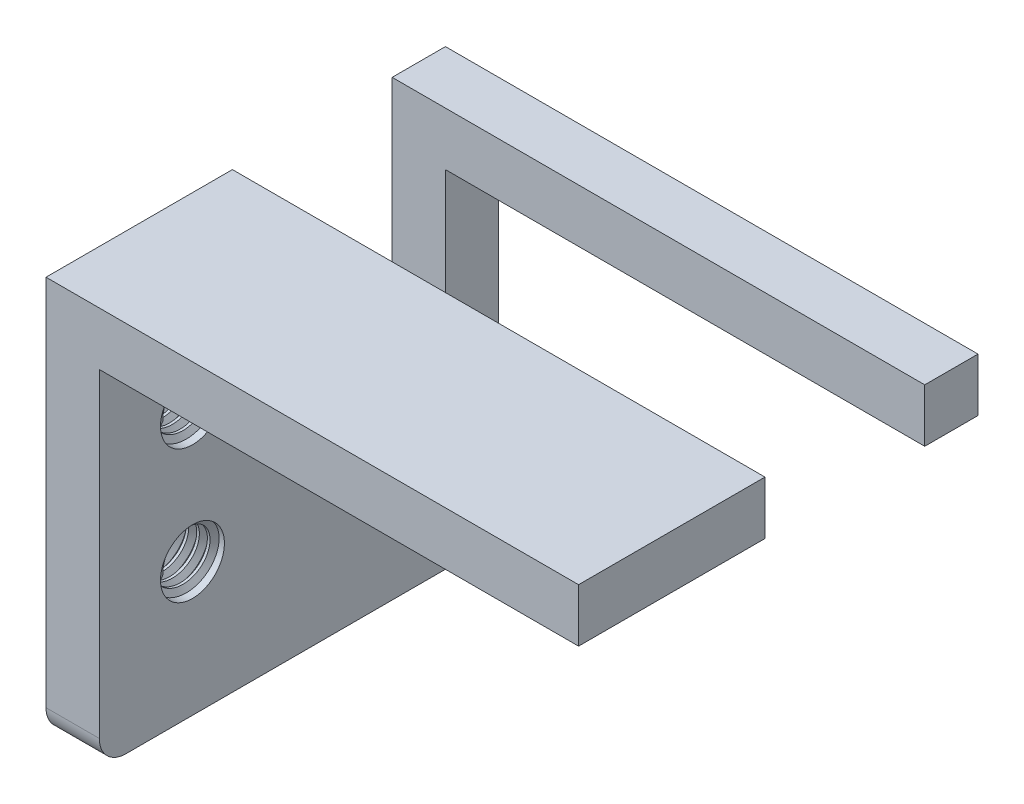
from build123d import *

# Parameters (mm, degrees)
BOSS_EXTRUDE1_DEPTH     = 15
CUT_EXTRUDE1_DEPTH      = 27.795522014
CUT_EXTRUDE1_DEPTH_BACK = 27.795522014
SKETCH2_W               = 6
SKETCH2_H               = 7
M2_CLEARANCE_HOLE1_D    = 2.4
THREAD1_PITCH           = 0.4
LPATTERN2_COUNT         = 2
LPATTERN2_PITCH         = 5
FILLET2_R               = 1


with BuildPart() as part:
    # Sketch1 → Boss-Extrude1 (new body)
    with BuildSketch(Plane.XY):
        Polygon((0, 0), (18, 0), (18, 2), (-2, 2), (-2, -13), (0, -13), align=None)
    extrude(amount=BOSS_EXTRUDE1_DEPTH)

    # Sketch2 → Cut-Extrude1 (cut, two sides: drawn at the far end of the back side and taken through both)
    with BuildSketch(Plane(origin=(0, 0, 0), x_dir=(0, 0, -1), z_dir=(1, 0, 0)).offset(-CUT_EXTRUDE1_DEPTH_BACK)):
        with Locations((-5, -1.5)):
            Rectangle(SKETCH2_W, SKETCH2_H)
    extrude(amount=CUT_EXTRUDE1_DEPTH + CUT_EXTRUDE1_DEPTH_BACK, mode=Mode.SUBTRACT)

    # M2 Clearance Hole1 (through all)
    with Locations(Plane(origin=(0, 0, 0), x_dir=(0, 0, -1), z_dir=(1, 0, 0))):
        with Locations((-11.5, -3)):
            m2_clearance_hole1 = Hole(M2_CLEARANCE_HOLE1_D / 2)

    # Thread1: the profile of Thread Profile1 profile screwed along a right-hand helix of 5 turns, 6 arcs to a turn; built about Z, then put on its axis
    thread1_z = Axis((0, 0, 0), (0, 0, 1))
    thread1_corners = [(1.2003, 0, -0.000173205), (1.2003, 0, 0.350173204), (0.98349365, 0, 0.224999999), (0.98349365, 0, 0.124999999)]
    with BuildLine(mode=Mode.PRIVATE) as thread1_profile:
        Line(thread1_corners[0], thread1_corners[1])
        Line(thread1_corners[1], thread1_corners[2])
        Line(thread1_corners[2], thread1_corners[3])
        Line(thread1_corners[3], thread1_corners[0])
    thread1_cap = Face(thread1_profile.wire())
    thread1_turn_angles = [0, 30, 60, 90, 120, 150, 180, 210, 240, 270, 300, 330, 360]
    thread1_turn_weights = [1, 0.8660254037844387, 1, 0.8660254037844387, 1, 0.8660254037844387, 1, 0.8660254037844387, 1, 0.8660254037844387, 1, 0.8660254037844387, 1]
    thread1_turn_rails = [Edge.make_bspline([Vector(p[0], p[1], 0).rotate(thread1_z, thread1_turn_angles[k]) / thread1_turn_weights[k] + Vector(0, 0, p[2] + THREAD1_PITCH * thread1_turn_angles[k] / 360) for k in range(13)], [0, 0, 0, 1, 1, 2, 2, 3, 3, 4, 4, 5, 5, 6, 6, 6], 2, thread1_turn_weights) for p in thread1_corners]
    thread1_turn_sides = [Face.make_surface_from_curves(thread1_turn_rails[p[0]], thread1_turn_rails[p[1]]) for p in [(0, 1), (1, 2), (2, 3), (3, 0)]]
    thread1 = Plane(origin=(0, -3, 11.5), x_dir=(0, 0, 1), z_dir=(-1, 0, 0)) * Solid(Shell([*[p.moved(Location((0, 0, THREAD1_PITCH * i))) for i in range(5) for p in thread1_turn_sides], thread1_cap, thread1_cap.rotate(thread1_z, 1800).moved(Location((0, 0, THREAD1_PITCH * 1800 / 360)))]))
    add(thread1)

    # LPattern2: M2 Clearance Hole1, Thread1 ×2
    with Locations(*[(0, -i * LPATTERN2_PITCH, 0) for i in range(1, LPATTERN2_COUNT)]):
        add(m2_clearance_hole1, mode=Mode.SUBTRACT)
        add(thread1)

    # Fillet2
    fillet2_edges = [part.edges().sort_by_distance(p)[0] for p in [
        (-1, -13, 15),
        (-1, -13, 0),
    ]]
    fillet(fillet2_edges, radius=FILLET2_R)


solid = part.part
